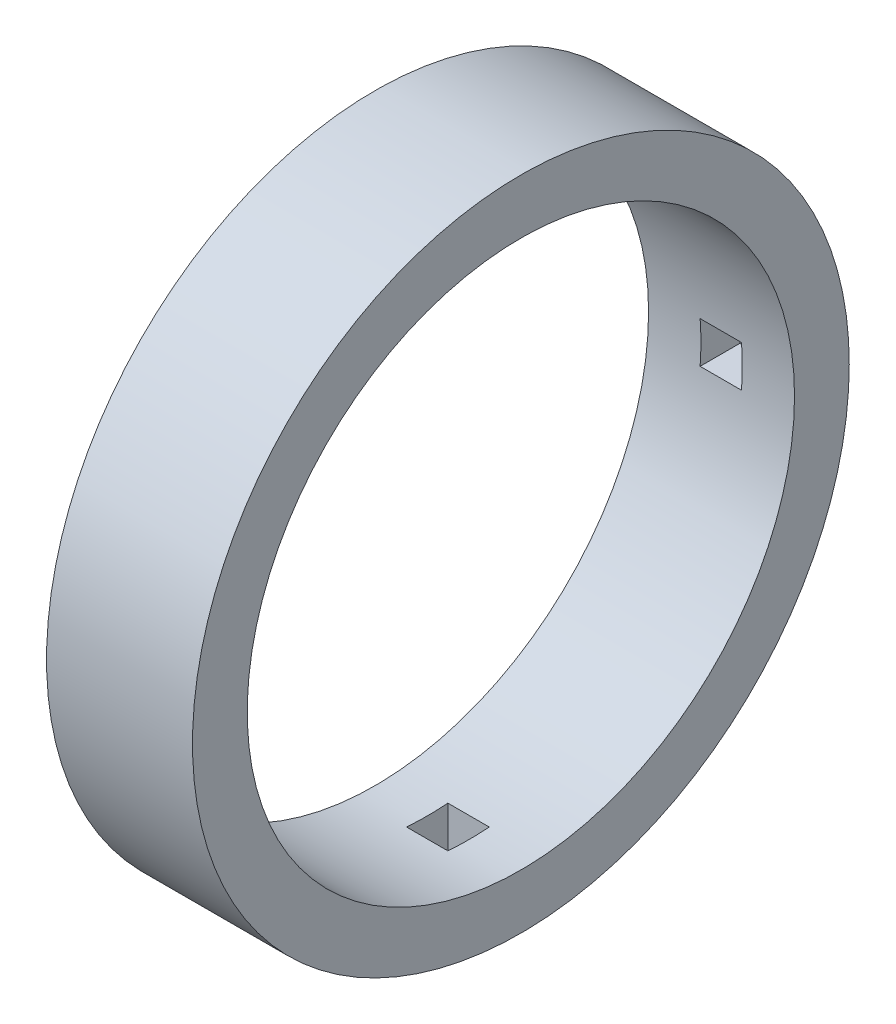
from build123d import *

# Parameters (mm, degrees)
SKETCH1_R           = 27
SKETCH1_R_2         = 22.5
BOSS_EXTRUDE1_DEPTH = 12
CUT_EXTRUDE1_DEPTH  = 1.7
CIRPATTERN1_COUNT   = 4


with BuildPart() as part:
    # Sketch1 → Boss-Extrude1 (new body)
    with BuildSketch(Plane(origin=(0, 0, 0), x_dir=(0, 0, -1), z_dir=(1, 0, 0))):
        Circle(SKETCH1_R)
        Circle(SKETCH1_R_2, mode=Mode.SUBTRACT)
    extrude(amount=BOSS_EXTRUDE1_DEPTH)

    # 3DSketch1 → Cut-Extrude1 (cut, symmetric)
    with BuildSketch(Plane(origin=(6, 1.7, 25.7), x_dir=(0, -0.7071067811865476, -0.7071067811865476), z_dir=(1, 0, 0))):
        Polygon((0, 0), (2.404163056, 2.404163056), (4.808326112, 0), (2.404163056, -2.404163056), align=None)
    cut_extrude1 = extrude(amount=CUT_EXTRUDE1_DEPTH, both=True, mode=Mode.SUBTRACT)

    # CirPattern1: Cut-Extrude1 ×4 about axis
    cirpattern1_axis = Axis((12, 0, 0), (-1, 0, 0))
    for i in range(1, CIRPATTERN1_COUNT):
        add(cut_extrude1.rotate(cirpattern1_axis, i * 360 / CIRPATTERN1_COUNT), mode=Mode.SUBTRACT)


solid = part.part
